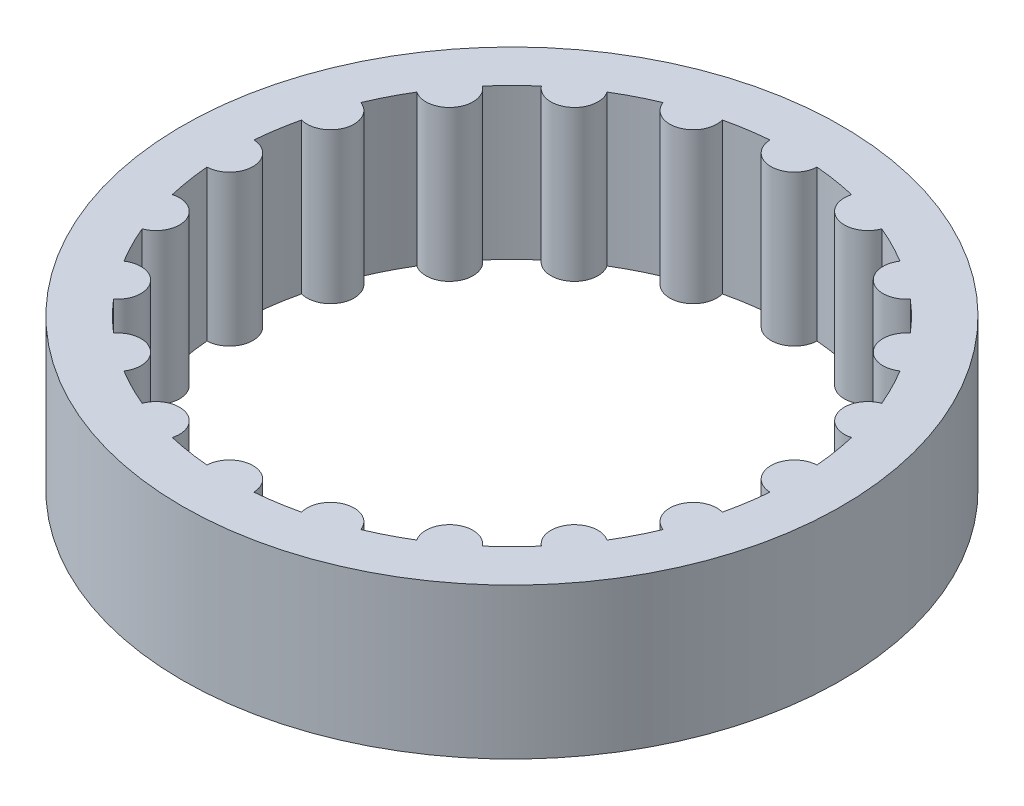
from build123d import *

# Parameters (mm, degrees)
BOSS_EXTRUDE1_DEPTH      = 8
BOSS_EXTRUDE1_DEPTH_BACK = 8
MAIN_R                   = 35


with BuildPart() as part:
    # MAIN → Boss-Extrude1 (new, two sides: drawn at the far end of the back side and taken through both)
    with BuildSketch(Plane(origin=(0, 0, 0), x_dir=(1, 0, 0), z_dir=(0, 1, 0)).offset(-BOSS_EXTRUDE1_DEPTH_BACK)):
        with Locations((-1.2, 0)):
            Circle(MAIN_R)
        with BuildLine():
            ThreePointArc((28.695833333, 2.497828918), (26.3, 0), (28.695833333, -2.497828918))
            ThreePointArc((28.695833333, -2.497828918), (28.430650218, -4.693033951), (28.004498687, -6.862744092))
            ThreePointArc((28.004498687, -6.862744092), (24.954054198, -8.497967345), (26.460755517, -11.61389703))
            ThreePointArc((26.460755517, -11.61389703), (25.530195726, -13.619714992), (24.454424229, -15.551543894))
            ThreePointArc((24.454424229, -15.551543894), (21.047967345, -16.164094438), (21.518050227, -19.593115982))
            ThreePointArc((21.518050227, -19.593115982), (20.013203436, -21.213203436), (18.393115982, -22.718050227))
            ThreePointArc((18.393115982, -22.718050227), (14.964094438, -22.247967345), (14.351543894, -25.654424229))
            ThreePointArc((14.351543894, -25.654424229), (12.419714992, -26.730195726), (10.413897031, -27.660755517))
            ThreePointArc((10.413897031, -27.660755517), (7.297967345, -26.154054198), (5.662744092, -29.204498687))
            ThreePointArc((5.662744092, -29.204498687), (3.493033951, -29.630650218), (1.297828919, -29.895833333))
            ThreePointArc((1.297828919, -29.895833333), (-1.2, -27.5), (-3.697828918, -29.895833333))
            ThreePointArc((-3.697828918, -29.895833333), (-5.893033951, -29.630650218), (-8.062744091, -29.204498687))
            ThreePointArc((-8.062744091, -29.204498687), (-9.697967345, -26.154054198), (-12.81389703, -27.660755517))
            ThreePointArc((-12.81389703, -27.660755517), (-14.819714992, -26.730195726), (-16.751543894, -25.654424229))
            ThreePointArc((-16.751543894, -25.654424229), (-17.364094438, -22.247967345), (-20.793115982, -22.718050227))
            ThreePointArc((-20.793115982, -22.718050227), (-22.413203435, -21.213203436), (-23.918050227, -19.593115982))
            ThreePointArc((-23.918050227, -19.593115982), (-23.447967345, -16.164094438), (-26.854424228, -15.551543894))
            ThreePointArc((-26.854424228, -15.551543894), (-27.930195725, -13.619714992), (-28.860755517, -11.61389703))
            ThreePointArc((-28.860755517, -11.61389703), (-27.354054198, -8.497967345), (-30.404498686, -6.862744092))
            ThreePointArc((-30.404498686, -6.862744092), (-30.830650218, -4.693033951), (-31.095833333, -2.497828918))
            ThreePointArc((-31.095833333, -2.497828918), (-28.7, 0), (-31.095833333, 2.497828918))
            ThreePointArc((-31.095833333, 2.497828918), (-30.830650218, 4.693033951), (-30.404498686, 6.862744092))
            ThreePointArc((-30.404498686, 6.862744092), (-27.354054198, 8.497967345), (-28.860755517, 11.61389703))
            ThreePointArc((-28.860755517, 11.61389703), (-27.930195725, 13.619714992), (-26.854424228, 15.551543894))
            ThreePointArc((-26.854424228, 15.551543894), (-23.447967345, 16.164094438), (-23.918050227, 19.593115982))
            ThreePointArc((-23.918050227, 19.593115982), (-22.413203435, 21.213203436), (-20.793115982, 22.718050227))
            ThreePointArc((-20.793115982, 22.718050227), (-17.364094438, 22.247967345), (-16.751543894, 25.654424229))
            ThreePointArc((-16.751543894, 25.654424229), (-14.819714992, 26.730195726), (-12.81389703, 27.660755517))
            ThreePointArc((-12.81389703, 27.660755517), (-9.697967345, 26.154054198), (-8.062744091, 29.204498687))
            ThreePointArc((-8.062744091, 29.204498687), (-5.893033951, 29.630650218), (-3.697828918, 29.895833333))
            ThreePointArc((-3.697828918, 29.895833333), (-1.2, 27.5), (1.297828919, 29.895833333))
            ThreePointArc((1.297828919, 29.895833333), (3.493033951, 29.630650218), (5.662744092, 29.204498687))
            ThreePointArc((5.662744092, 29.204498687), (7.297967345, 26.154054198), (10.413897031, 27.660755517))
            ThreePointArc((10.413897031, 27.660755517), (12.419714992, 26.730195726), (14.351543894, 25.654424229))
            ThreePointArc((14.351543894, 25.654424229), (14.964094438, 22.247967345), (18.393115982, 22.718050227))
            ThreePointArc((18.393115982, 22.718050227), (20.013203436, 21.213203436), (21.518050227, 19.593115982))
            ThreePointArc((21.518050227, 19.593115982), (21.047967345, 16.164094438), (24.454424229, 15.551543894))
            ThreePointArc((24.454424229, 15.551543894), (25.530195726, 13.619714992), (26.460755517, 11.61389703))
            ThreePointArc((26.460755517, 11.61389703), (24.954054198, 8.497967345), (28.004498687, 6.862744092))
            ThreePointArc((28.004498687, 6.862744092), (28.430650218, 4.693033951), (28.695833333, 2.497828918))
        make_face(mode=Mode.SUBTRACT)
    extrude(amount=BOSS_EXTRUDE1_DEPTH + BOSS_EXTRUDE1_DEPTH_BACK)


solid = part.part
